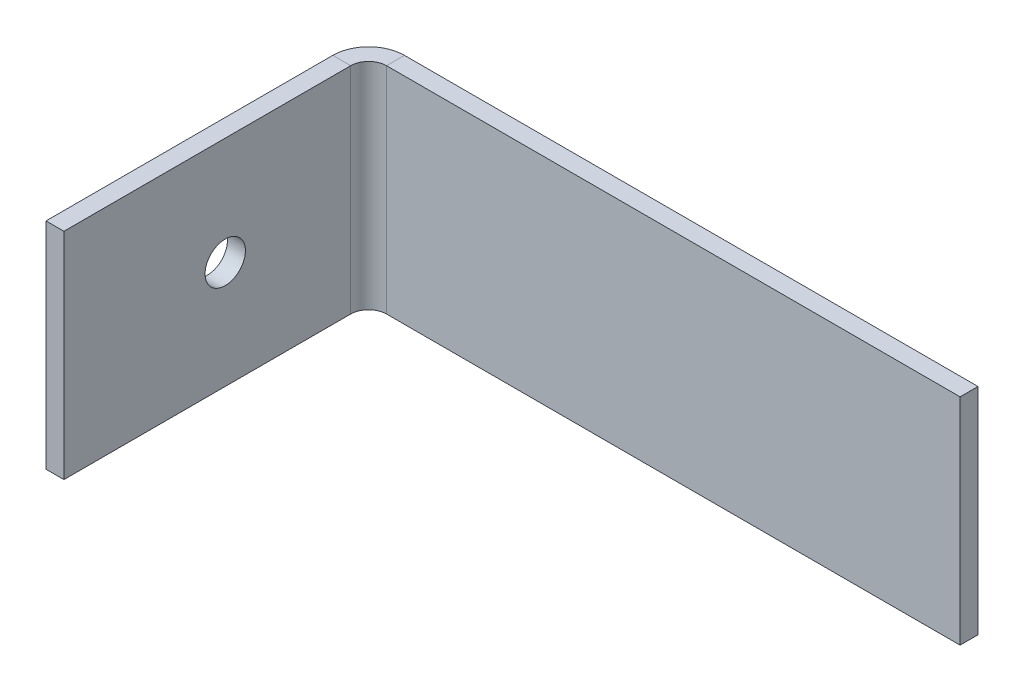
from build123d import *

# Parameters (mm, degrees)
SKETCH19_W                   = 215.9
SKETCH19_H                   = 76.2
BASE_FLANGE2_DEPTH           = 6.35
EDGE_FLANGE4_STRIP_W         = 38.1
EDGE_FLANGE4_STRIP_H         = 6.35
EDGE_FLANGE4_STRIP_CUT_DEPTH = 76.2
EDGE_FLANGE4_DEPTH           = 76.2
CUT_EXTRUDE1_REACH           = 240.78
SKETCH27_R                   = 7.14375


# Sheet-metal steps are written as plain solids
with BuildPart() as part:
    # Sketch19 → Base-Flange2 (new body)
    with BuildSketch(Plane.XY):
        Rectangle(SKETCH19_W, SKETCH19_H)
    extrude(amount=-BASE_FLANGE2_DEPTH)

    # Edge-Flange4 strip (across the edge) → Edge-Flange4 strip cut (cut)
    with BuildSketch(Plane(origin=(-107.95, 38.1, 0), x_dir=(1, 0, 0), z_dir=(0, -1, 0))):
        with Locations((-6.35, -3.175)):
            Rectangle(EDGE_FLANGE4_STRIP_W, EDGE_FLANGE4_STRIP_H)
    extrude(amount=EDGE_FLANGE4_STRIP_CUT_DEPTH, mode=Mode.SUBTRACT)

    # Edge-Flange4 section (across the edge) → Edge-Flange4 (add)
    with BuildSketch(Plane(origin=(-107.95, 38.1, 0), x_dir=(1, 0, 0), z_dir=(0, -1, 0))):
        with BuildLine():
            Line((0, 6.35), (0, 107.95))
            Line((0, 107.95), (6.35, 107.95))
            Line((6.35, 107.95), (6.35, 6.35))
            ThreePointArc((6.35, 6.35), (8.209871939, 1.859871939), (12.7, 0))
            Line((12.7, 0), (12.7, -6.35))
            ThreePointArc((12.7, -6.35), (3.719743879, -2.630256121), (0, 6.35))
        make_face()
    extrude(amount=EDGE_FLANGE4_DEPTH)

    # Sketch27 → Cut-Extrude1 (cut, up to next)
    with BuildSketch(Plane(origin=(-101.6, 0, 0), x_dir=(0, 0, -1), z_dir=(1, 0, 0)), mode=Mode.PRIVATE) as cut_extrude1_sk1:
        with Locations((-50.8, 0)):
            Circle(SKETCH27_R)
    cut_extrude1_tool1 = extrude(cut_extrude1_sk1.sketch, amount=-CUT_EXTRUDE1_REACH, mode=Mode.PRIVATE) & part.part
    add(cut_extrude1_tool1.solids().sort_by_distance((-101.6, 0, 50.8))[0], mode=Mode.SUBTRACT)


solid = part.part
